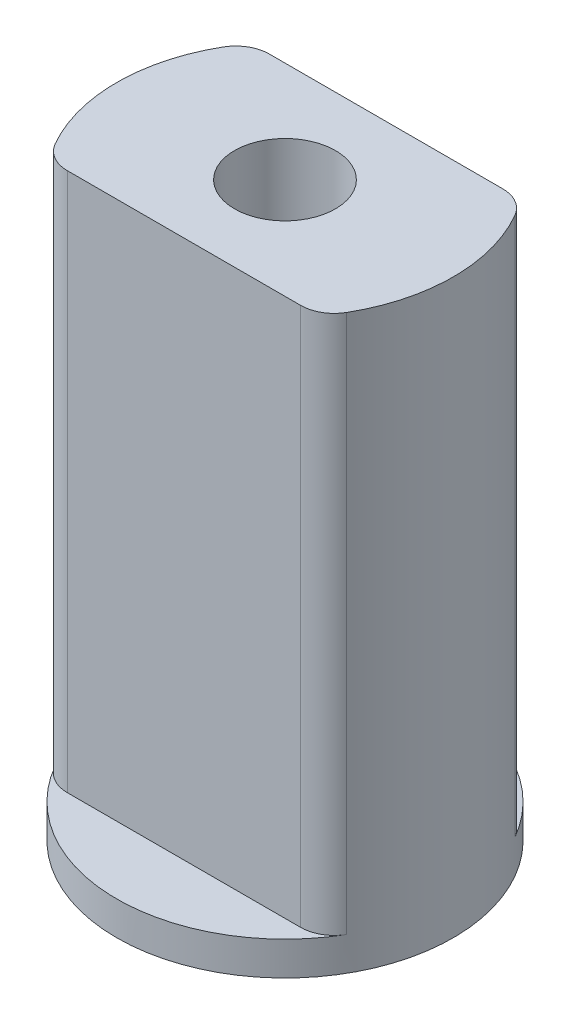
from build123d import *

# Parameters (mm, degrees)
SKETCH2_R           = 2.5
BOSS_EXTRUDE1_DEPTH = 0.5
BOSS_EXTRUDE2_DEPTH = 8
FILLET1_R           = 0.5


with BuildPart() as part:
    # Sketch2 → Boss-Extrude1 (new body)
    with BuildSketch(Plane(origin=(0, 0, 0), x_dir=(1, 0, 0), z_dir=(0, 1, 0))):
        with Locations(Location((0, 0, 0), (0, 0, 270))):
            Circle(SKETCH2_R)
    extrude(amount=BOSS_EXTRUDE1_DEPTH)

    # Sketch3 → Boss-Extrude2 (add)
    with BuildSketch(Plane(origin=(0, 0.5, 0), x_dir=(1, 0, 0), z_dir=(0, 1, 0))):
        with BuildLine():
            Line((2, 1.5), (-2, 1.5))
            ThreePointArc((-2, 1.5), (-2.371708245, 0.790569415), (-2.5, 0))
            Line((-2.5, 0), (-0.75, 0))
            ThreePointArc((-0.75, 0), (0, 0.75), (0.75, 0))
            Line((0.75, 0), (2.5, 0))
            ThreePointArc((2.5, 0), (2.371708245, 0.790569415), (2, 1.5))
        make_face()
        with BuildLine():
            Line((-0.75, 0), (-2.5, 0))
            ThreePointArc((-2.5, 0), (-2.371708245, -0.790569415), (-2, -1.5))
            Line((-2, -1.5), (2, -1.5))
            ThreePointArc((2, -1.5), (2.371708245, -0.790569415), (2.5, 0))
            Line((2.5, 0), (0.75, 0))
            ThreePointArc((0.75, 0), (0, -0.75), (-0.75, 0))
        make_face()
    extrude(amount=BOSS_EXTRUDE2_DEPTH)

    # Fillet1
    # the kernel refuses this fillet: 0.5 mm, written as the material it takes off along each edge
    with BuildSketch(Plane(origin=(-2, 0.5, -1.5), x_dir=(-0.5509898714915042, 0, 0.8345119301206998), z_dir=(0, 1, 0)), Plane(origin=(2, 0.5, 1.5), x_dir=(0.5509898714915042, 0, -0.8345119301206998), z_dir=(0, 1, 0))) as fillet1_piece_1:
        with BuildLine():
            CenterArc((0.269618674, 0.499101733), FILLET1_R, 213.434948823, 60)
            Line((-0.147637291, 0.223606798), (0, 0))
            ThreePointArc((0, 0), (0.149788152, -0.004491333), (0.299576304, 0))
        make_face()
    extrude(amount=8.748940761, mode=Mode.SUBTRACT)
    with BuildSketch(Plane(origin=(2, 0.5, -1.5), x_dir=(0.5509898714915049, 0, 0.8345119301206994), z_dir=(0, 1, 0)), Plane(origin=(-2, 0.5, 1.5), x_dir=(-0.5509898714915045, 0, -0.8345119301206995), z_dir=(0, 1, 0))) as fillet1_piece_2:
        with BuildLine():
            CenterArc((0.269618674, -0.499101733), FILLET1_R, 86.565051177, 60)
            Line((-0.147637291, -0.223606798), (0, 0))
            ThreePointArc((0, 0), (0.149788152, 0.004491333), (0.299576304, 0))
        make_face()
    extrude(amount=8.748940761, mode=Mode.SUBTRACT)


solid = part.part
